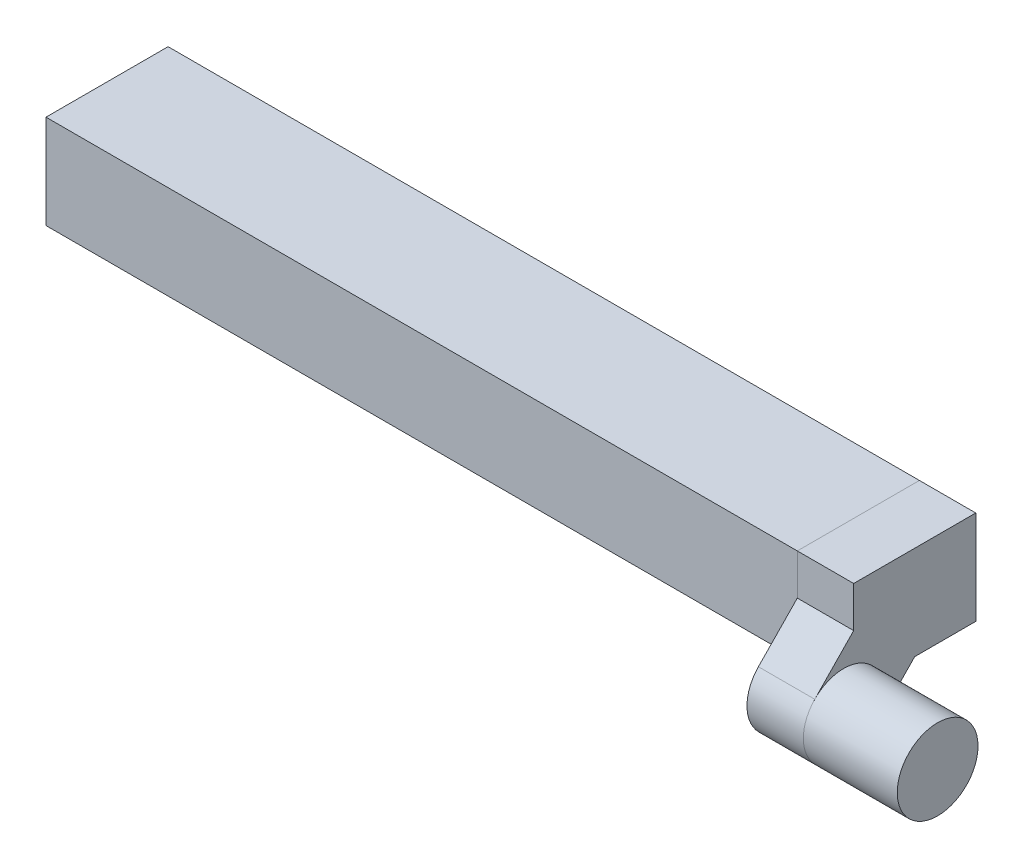
from build123d import *

# Parameters (mm, degrees)
SKETCH2_W           = 6.5
SKETCH2_H           = 5
SKETCH2_W_2         = 4.1
SKETCH2_H_2         = 4.1
BOSS_EXTRUDE1_DEPTH = 10
BOSS_EXTRUDE2_START = 15
SKETCH2_2_W         = 6.5
SKETCH2_2_H         = 5
BOSS_EXTRUDE2_DEPTH = 25
BOSS_EXTRUDE3_DEPTH = 3
SKETCH6_R           = 2.15
BOSS_EXTRUDE4_DEPTH = 5
BOSS_EXTRUDE5_START = 10
SKETCH2_4_W         = 6.5
SKETCH2_4_H         = 5
SKETCH2_4_W_2       = 4.1
SKETCH2_4_H_2       = 4.1
BOSS_EXTRUDE5_DEPTH = 5


with BuildPart() as part:
    # Sketch2 → Boss-Extrude1 (new body)
    with BuildSketch(Plane(origin=(0, 0, 0), x_dir=(0, 0, -1), z_dir=(1, 0, 0))):
        Rectangle(SKETCH2_W, SKETCH2_H)
        Rectangle(SKETCH2_W_2, SKETCH2_H_2, mode=Mode.SUBTRACT)
    extrude(amount=BOSS_EXTRUDE1_DEPTH)



with BuildPart() as body_2:
    # Sketch2<2> → Boss-Extrude2 (new body)
    with BuildSketch(Plane(origin=(0, 0, 0), x_dir=(0, 0, -1), z_dir=(1, 0, 0)).offset(BOSS_EXTRUDE2_START)):
        Rectangle(SKETCH2_2_W, SKETCH2_2_H)
    extrude(amount=BOSS_EXTRUDE2_DEPTH)


with BuildPart() as body_3:
    # Sketch5 → Boss-Extrude3 (new body)
    with BuildSketch(Plane(origin=(40, 0, 0), x_dir=(0, 0, -1), z_dir=(1, 0, 0))):
        with BuildLine():
            Line((-3.25, 2.5), (3.25, 2.5))
            Line((3.25, 2.5), (3.25, -2.5))
            Line((3.25, -2.5), (0, -2.5))
            Line((0, -2.5), (-2.239469646, -4.802141646))
            ThreePointArc((-2.239469646, -4.802141646), (-5.279739345, -4.844095871), (-5.32169357, -1.803826172))
            Line((-5.32169357, -1.803826172), (-3.25, 0.325844152))
            Line((-3.25, 0.325844152), (-3.25, 2.5))
        make_face()
    extrude(amount=BOSS_EXTRUDE3_DEPTH)


with BuildPart() as body_4:
    # Sketch6 → Boss-Extrude4 (new body)
    with BuildSketch(Plane(origin=(43, 0, 0), x_dir=(0, 0, -1), z_dir=(1, 0, 0))):
        with Locations((-3.780581608, -3.302983909)):
            Circle(SKETCH6_R)
    extrude(amount=BOSS_EXTRUDE4_DEPTH)


with BuildPart() as part_1:
    add(part.part)

    add(body_2.part)  # Boss-Extrude5 merges body 2
    # Sketch2<4> → Boss-Extrude5 (add)
    with BuildSketch(Plane(origin=(0, 0, 0), x_dir=(0, 0, -1), z_dir=(1, 0, 0)).offset(BOSS_EXTRUDE5_START)):
        Rectangle(SKETCH2_4_W, SKETCH2_4_H)
        Rectangle(SKETCH2_4_W_2, SKETCH2_4_H_2, mode=Mode.SUBTRACT)
    extrude(amount=BOSS_EXTRUDE5_DEPTH)


solid = Compound([body_3.part, body_4.part, part_1.part])
